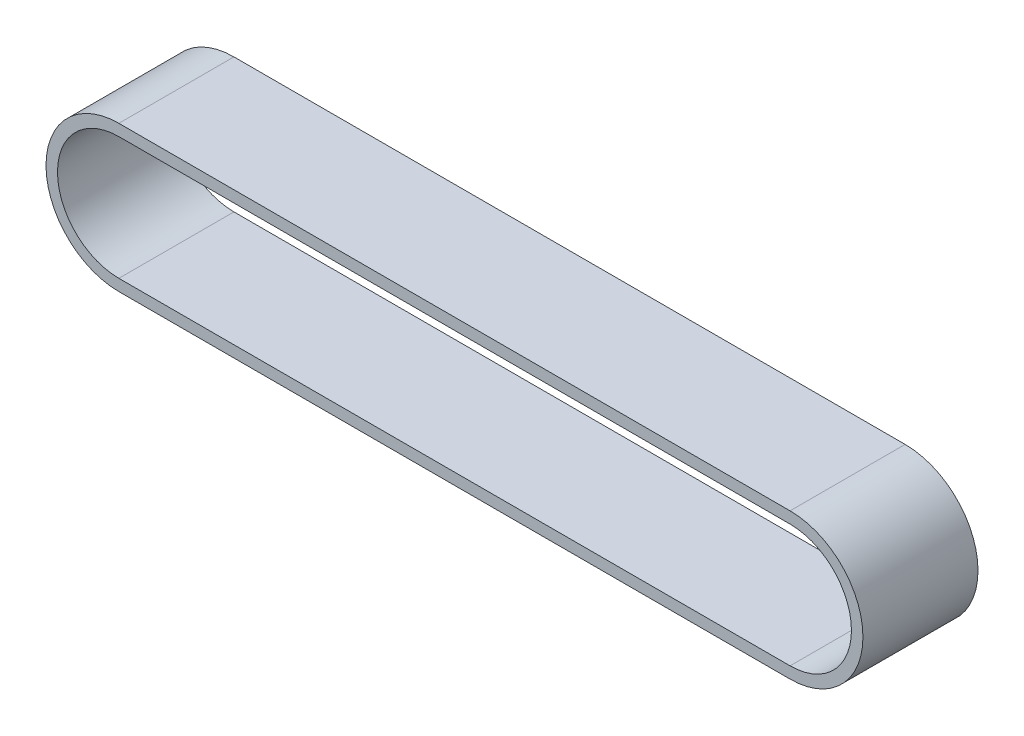
from build123d import *

# Parameters (mm, degrees)
BOSS_EXTRUDE1_DEPTH = 30


with BuildPart() as part:
    # Sketch1 → Boss-Extrude1 (new body)
    with BuildSketch(Plane.XY):
        with BuildLine():
            Line((87.5, -19), (-87.5, -19))
            ThreePointArc((-87.5, -19), (-106.5, 0), (-87.5, 19))
            Line((-87.5, 19), (87.5, 19))
            ThreePointArc((87.5, 19), (106.5, 0), (87.5, -19))
        make_face()
        with BuildLine():
            Line((87.5, -16), (-87.5, -16))
            ThreePointArc((-87.5, -16), (-103.5, 0), (-87.5, 16))
            Line((-87.5, 16), (87.5, 16))
            ThreePointArc((87.5, 16), (103.5, 0), (87.5, -16))
        make_face(mode=Mode.SUBTRACT)
    extrude(amount=BOSS_EXTRUDE1_DEPTH)


solid = part.part
